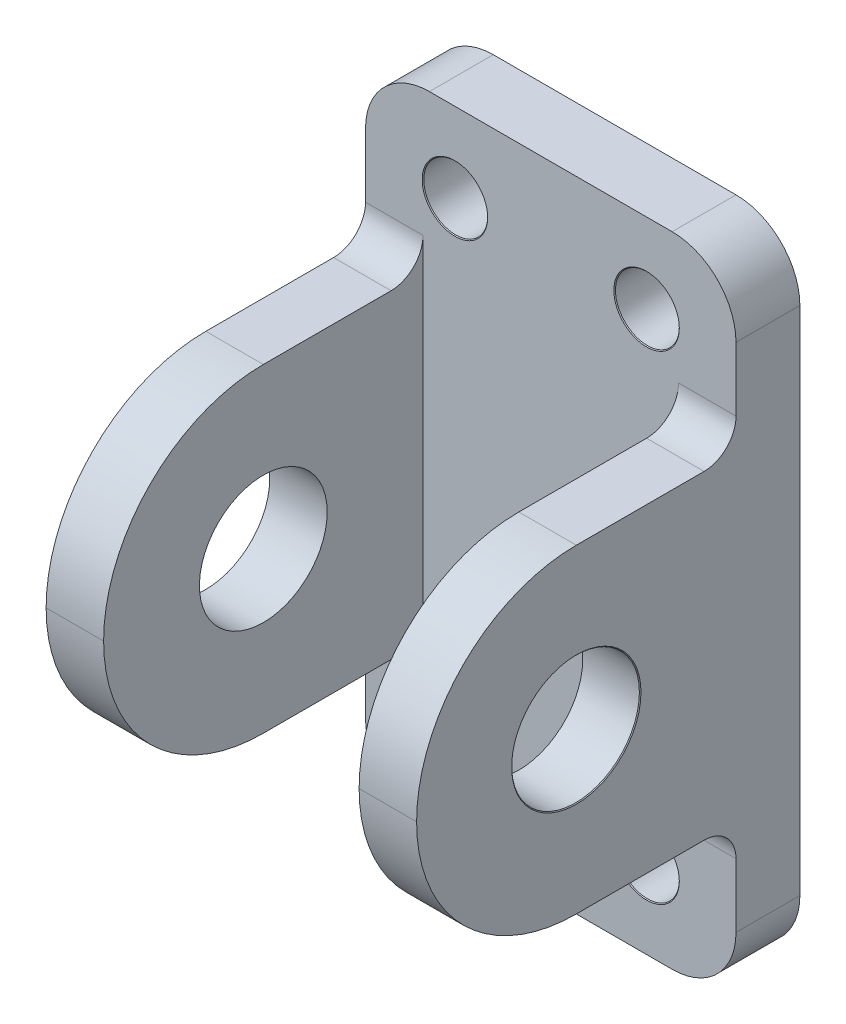
from build123d import *

# Parameters (mm, degrees)
SKETCH1_W                       = 20
SKETCH1_H                       = 11.6
BOSS_EXTRUDE1_DEPTH             = 2
SKETCH2_W                       = 10
SKETCH2_H                       = 1.8
BOSS_EXTRUDE2_DEPTH             = 10
FILLET1_R                       = 5
F_4_0MM_DOWEL_HOLE1_D           = 4
F_4_0MM_DOWEL_HOLE1_CSINK_D     = 4.05
F_4_0MM_DOWEL_HOLE1_CSINK_ANGLE = 90
F_2_0MM_DOWEL_HOLE1_D           = 2
F_2_0MM_DOWEL_HOLE1_CSINK_D     = 2.05
F_2_0MM_DOWEL_HOLE1_CSINK_ANGLE = 90
FILLET2_R                       = 2
FILLET3_R                       = 1


with BuildPart() as part:
    # Sketch1 → Boss-Extrude1 (new body)
    with BuildSketch(Plane(origin=(0, 0, 0), x_dir=(0, 1, 0), z_dir=(0, 0, 1))):
        Rectangle(SKETCH1_W, SKETCH1_H)
    extrude(amount=-BOSS_EXTRUDE1_DEPTH)

    # Sketch2 → Boss-Extrude2 (add)
    with BuildSketch(Plane(origin=(0, 0, 0), x_dir=(0, 1, 0), z_dir=(0, 0, 1))):
        with Locations((0, 4.9)):
            Rectangle(SKETCH2_W, SKETCH2_H)
        with Locations((0, -4.9)):
            Rectangle(SKETCH2_W, SKETCH2_H)
    extrude(amount=BOSS_EXTRUDE2_DEPTH)

    # Fillet1
    fillet1_edges = [part.edges().sort_by_distance(p)[0] for p in [
        (4.9, 5, 10),
        (4.9, -5, 10),
        (-4.9, 5, 10),
        (-4.9, -5, 10),
    ]]
    fillet(fillet1_edges, radius=FILLET1_R - 0.0001)  # a hair under: the kernel refuses the full size

    # Ø4.0mm Dowel Hole1 (through all)
    with Locations(Plane.YZ.offset(5.8)):
        with Locations((0, 5)):
            CounterSinkHole(F_4_0MM_DOWEL_HOLE1_D / 2, F_4_0MM_DOWEL_HOLE1_CSINK_D / 2, counter_sink_angle=F_4_0MM_DOWEL_HOLE1_CSINK_ANGLE)

    # Ø2.0mm Dowel Hole1 (through all)
    with Locations(Plane(origin=(0, 0, 0), x_dir=(0, 1, 0), z_dir=(0, 0, 1))):
        with Locations((7.5, -3), (-7.5, 3), (-7.5, -3), (7.5, 3)):
            CounterSinkHole(F_2_0MM_DOWEL_HOLE1_D / 2, F_2_0MM_DOWEL_HOLE1_CSINK_D / 2, counter_sink_angle=F_2_0MM_DOWEL_HOLE1_CSINK_ANGLE)

    # Fillet2
    fillet2_edges = [part.edges().sort_by_distance(p)[0] for p in [
        (-5.8, -10, -1),
        (-5.8, 10, -1),
        (5.8, 10, -1),
        (5.8, -10, -1),
    ]]
    fillet(fillet2_edges, radius=FILLET2_R)

    # Fillet3
    fillet3_edges = [part.edges().sort_by_distance(p)[0] for p in [
        (-4.9, -5, 0),
        (-4.9, 5, 0),
        (4.9, -5, 0),
        (4.9, 5, 0),
    ]]
    fillet(fillet3_edges, radius=FILLET3_R)


solid = part.part
